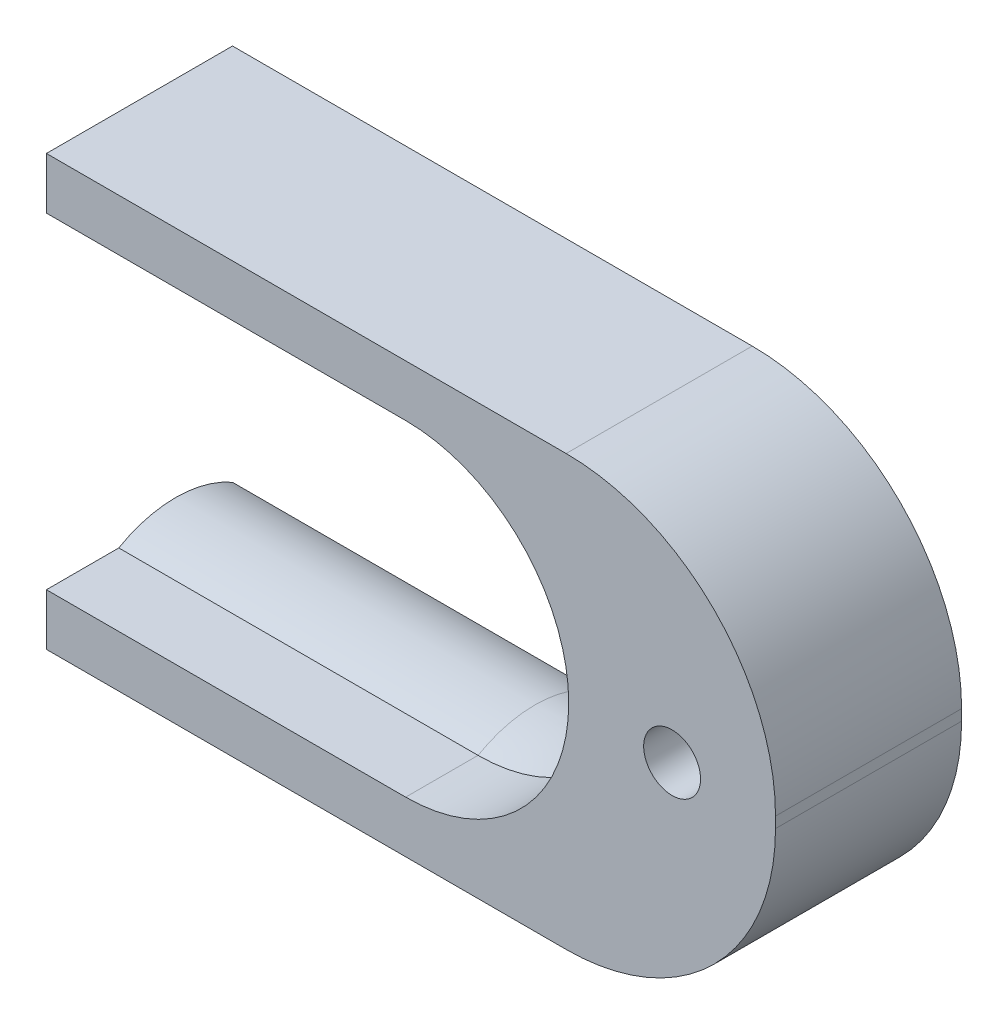
from build123d import *

# Parameters (mm, degrees)
BOSS_EXTRUDE1_DEPTH                                 = 12.5
BOSS_EXTRUDE1_DEPTH_BACK                            = 5.5
SKETCH3_R                                           = 2.75
CBORE_FOR_M5_HEX_SOCKET_HEAD_CAP_SCREW2_D           = 5.5
CBORE_FOR_M5_HEX_SOCKET_HEAD_CAP_SCREW2_CBORE_D     = 10
CBORE_FOR_M5_HEX_SOCKET_HEAD_CAP_SCREW2_CBORE_DEPTH = 5.4


with BuildPart() as part:
    # Sweep1: sweep along a path in Sketch1
    with BuildLine(Plane.XY) as sweep1_path:
        Line((0, 0), (34.75, 0))
        ThreePointArc((34.75, 0), (49.05, 14.3), (34.75, 28.6))
        Line((34.75, 28.6), (0, 28.6))
    # Sketch2 → Sweep1 (sweep)
    with BuildSketch(Plane(origin=(0, 0, 0), x_dir=(0, 0, -1), z_dir=(1, 0, 0))):
        with BuildLine():
            Line((-5.5, -1.473720558), (5.5, -1.473720558))
            ThreePointArc((5.5, -1.473720558), (0, 0), (-5.5, -1.473720558))
        make_face()
    sweep(path=sweep1_path.line)

    # Sketch3 → Boss-Extrude1 (add, two sides: drawn at the far end of the back side and taken through both)
    with BuildSketch(Plane.XY.offset(-BOSS_EXTRUDE1_DEPTH_BACK)):
        with BuildLine():
            Line((0, 30.073720558), (0, 35.073720558))
            Line((0, 35.073720558), (50.273720558, 35.073720558))
            ThreePointArc((50.273720558, 35.073720558), (64.592632877, 29.142632877), (70.523720558, 14.823720558))
            Line((70.523720558, 14.823720558), (70.523720558, 13.776279442))
            ThreePointArc((70.523720558, 13.776279442), (64.592632877, -0.542632877), (50.273720558, -6.473720558))
            Line((50.273720558, -6.473720558), (0, -6.473720558))
            Line((0, -6.473720558), (0, -1.473720558))
            Line((0, -1.473720558), (34.75, -1.473720558))
            ThreePointArc((34.75, -1.473720558), (50.523720558, 14.3), (34.75, 30.073720558))
            Line((34.75, 30.073720558), (0, 30.073720558))
        make_face()
        with Locations((60.523720558, 14.3)):
            Circle(SKETCH3_R, mode=Mode.SUBTRACT)
    extrude(amount=BOSS_EXTRUDE1_DEPTH + BOSS_EXTRUDE1_DEPTH_BACK)

    # CBORE for M5 Hex Socket Head Cap Screw2 (through all)
    with Locations(Plane(origin=(0, 0, -5.5), x_dir=(-1, 0, 0), z_dir=(0, 0, -1))):
        with Locations((-60.523720558, 14.3)):
            CounterBoreHole(CBORE_FOR_M5_HEX_SOCKET_HEAD_CAP_SCREW2_D / 2, CBORE_FOR_M5_HEX_SOCKET_HEAD_CAP_SCREW2_CBORE_D / 2, CBORE_FOR_M5_HEX_SOCKET_HEAD_CAP_SCREW2_CBORE_DEPTH)


solid = part.part
